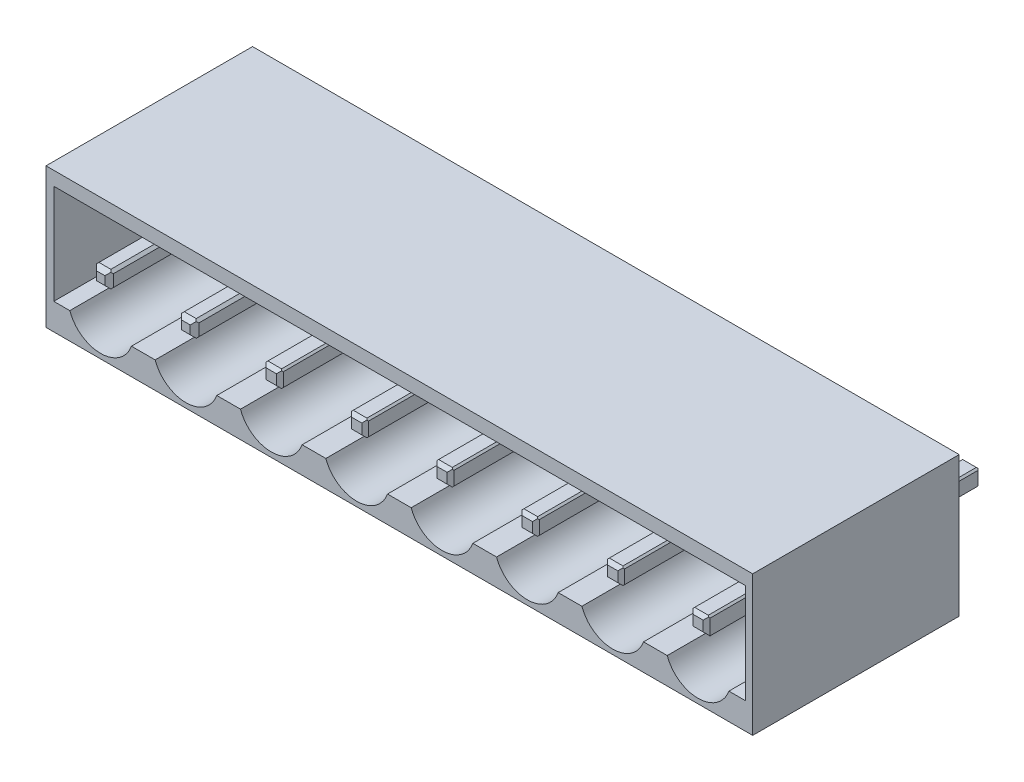
from build123d import *

# Parameters (mm, degrees)
SKETCH_1_W          = 41.4
SKETCH_1_H          = 8.2
EXTRUDE_1_DEPTH     = 12.1
SKETCH_4_R          = 1.25
CUT_EXTRUDE_3_DEPTH = 8
CUT_EXTRUDE_4_DEPTH = 7.8
SKETCH_7_W          = 1
SKETCH_7_H          = 1
EXTRUDE_2_DEPTH     = 8
CHAMFER_1_SIZE      = 0.15
CHAMFER_2_SIZE      = 0.25
SKETCH_8_W          = 1
SKETCH_8_H          = 1
EXTRUDE_3_DEPTH     = 4
CHAMFER_6_SIZE      = 0.1
CHAMFER_7_SIZE      = 0.2
CHAMFER_10_SIZE     = 0.1
CHAMFER_11_SIZE     = 0.2
CHAMFER_12_SIZE     = 0.1
CHAMFER_13_SIZE     = 0.2
CHAMFER_14_SIZE     = 0.1
CHAMFER_15_SIZE     = 0.2


with BuildPart() as part:
    # Эскиз1 → Бобышка-Вытянуть1 (new body)
    with BuildSketch(Plane.XY):
        Rectangle(SKETCH_1_W, SKETCH_1_H)
    extrude(amount=EXTRUDE_1_DEPTH)

    # Эскиз4 → Вырез-Вытянуть3 (cut)
    with BuildSketch(Plane.XY.offset(12.1)):
        with Locations((-17.5, 0)):
            Circle(SKETCH_4_R)
        with Locations((-12.5, 0)):
            Circle(SKETCH_4_R)
        with Locations((-7.5, 0)):
            Circle(SKETCH_4_R)
        with Locations((-2.5, 0)):
            Circle(SKETCH_4_R)
        with Locations((2.5, 0)):
            Circle(SKETCH_4_R)
        with Locations((7.5, 0)):
            Circle(SKETCH_4_R)
        with Locations((12.5, 0)):
            Circle(SKETCH_4_R)
        with Locations((17.5, 0)):
            Circle(SKETCH_4_R)
    extrude(amount=-CUT_EXTRUDE_3_DEPTH, mode=Mode.SUBTRACT)

    # Эскиз5 → Вырез-Вытянуть4 (cut)
    with BuildSketch(Plane.XY.offset(12.1)):
        with BuildLine():
            Line((-20.245621634, 0), (-20.245621634, 3.292901982))
            Line((-20.245621634, 3.292901982), (-9.721490456, 3.292901982))
            Line((-9.721490456, 3.292901982), (-4.721490456, 3.292901982))
            Line((-4.721490456, 3.292901982), (0.278509544, 3.292901982))
            Line((0.278509544, 3.292901982), (10.278509544, 3.292901982))
            Line((10.278509544, 3.292901982), (20.278509544, 3.292901982))
            Line((20.278509544, 3.292901982), (20.278509544, -2.548957219))
            Line((20.278509544, -2.548957219), (19.30582632, -2.548957219))
            ThreePointArc((19.30582632, -2.548957219), (17.5, -3.818893996), (15.69417368, -2.548957219))
            Line((15.69417368, -2.548957219), (14.30582632, -2.548957219))
            ThreePointArc((14.30582632, -2.548957219), (12.5, -3.818893996), (10.69417368, -2.548957219))
            Line((10.69417368, -2.548957219), (9.30582632, -2.548957219))
            ThreePointArc((9.30582632, -2.548957219), (7.5, -3.818893996), (5.69417368, -2.548957219))
            Line((5.69417368, -2.548957219), (4.30582632, -2.548957219))
            ThreePointArc((4.30582632, -2.548957219), (2.5, -3.818893996), (0.69417368, -2.548957219))
            Line((0.69417368, -2.548957219), (-0.69417368, -2.548957219))
            ThreePointArc((-0.69417368, -2.548957219), (-2.5, -3.818893996), (-4.30582632, -2.548957219))
            Line((-4.30582632, -2.548957219), (-5.69417368, -2.548957219))
            ThreePointArc((-5.69417368, -2.548957219), (-7.5, -3.818893996), (-9.30582632, -2.548957219))
            Line((-9.30582632, -2.548957219), (-10.69417368, -2.548957219))
            ThreePointArc((-10.69417368, -2.548957219), (-12.5, -3.818893996), (-14.30582632, -2.548957219))
            Line((-14.30582632, -2.548957219), (-15.69417368, -2.548957219))
            ThreePointArc((-15.69417368, -2.548957219), (-17.5, -3.818893996), (-19.30582632, -2.548957219))
            Line((-19.30582632, -2.548957219), (-20.245621634, -2.548957219))
            Line((-20.245621634, -2.548957219), (-20.245621634, 0))
        make_face()
    extrude(amount=-CUT_EXTRUDE_4_DEPTH, mode=Mode.SUBTRACT)

    # Эскиз7 → Бобышка-Вытянуть2 (add)
    with BuildSketch(Plane.XY.offset(4.1)):
        with Locations((-12.5, 0)):
            Rectangle(SKETCH_7_W, SKETCH_7_H)
        with Locations((-17.5, 0)):
            Rectangle(SKETCH_7_W, SKETCH_7_H)
        with Locations((-7.5, 0)):
            Rectangle(SKETCH_7_W, SKETCH_7_H)
        with Locations((-2.5, 0)):
            Rectangle(SKETCH_7_W, SKETCH_7_H)
        with Locations((2.5, 0)):
            Rectangle(SKETCH_7_W, SKETCH_7_H)
        with Locations((7.5, 0)):
            Rectangle(SKETCH_7_W, SKETCH_7_H)
        with Locations((12.5, 0)):
            Rectangle(SKETCH_7_W, SKETCH_7_H)
        with Locations((17.5, 0)):
            Rectangle(SKETCH_7_W, SKETCH_7_H)
    extrude(amount=EXTRUDE_2_DEPTH)

    # Фаска1
    chamfer_1_edges = [part.edges().sort_by_distance(p)[0] for p in [
        (-17, -0.5, 8.1),
        (-17, 0.5, 8.1),
        (-18, 0.5, 8.1),
        (-18, -0.5, 8.1),
        (-12, -0.5, 8.1),
        (-12, 0.5, 8.1),
        (-13, 0.5, 8.1),
        (-13, -0.5, 8.1),
    ]]
    chamfer(chamfer_1_edges, length=CHAMFER_1_SIZE)

    # Фаска2
    # the kernel refuses this chamfer: 0.25 mm, written as the material it takes off along each edge
    with BuildSketch(Plane(origin=(-13, -0.992920747, 12.1), x_dir=(-0.027495876610589005, 0, -0.9996219169112968), z_dir=(0, 1, 0)), Plane(origin=(-13.492920747, 0.5, 12.1), x_dir=(0, 0.027495876610586414, -0.9996219169112968), z_dir=(1, 0, 0)), Plane(origin=(-12, 0.992920747, 12.1), x_dir=(0.027495876610589005, 0, -0.9996219169112968), z_dir=(0, -1, 0)), Plane(origin=(-11.507079253, -0.5, 12.1), x_dir=(0, -0.027495876610586414, -0.9996219169112968), z_dir=(-1, 0, 0)), Plane(origin=(-17, 0.992920747, 12.1), x_dir=(0.027495876610582105, 0, -0.999621916911297), z_dir=(0, -1, 0)), Plane(origin=(-16.507079253, -0.5, 12.1), x_dir=(0, -0.027495876610586414, -0.9996219169112968), z_dir=(-1, 0, 0)), Plane(origin=(-18, -0.992920747, 12.1), x_dir=(-0.027495876610582105, 0, -0.999621916911297), z_dir=(0, 1, 0)), Plane(origin=(-18.492920747, 0.5, 12.1), x_dir=(0, 0.027495876610586414, -0.9996219169112968), z_dir=(1, 0, 0))) as chamfer_2_piece_1:
        Polygon((CHAMFER_2_SIZE * 0.999621916911, -CHAMFER_2_SIZE * 0.0274958766106), (-CHAMFER_2_SIZE * 0.0274958766106, -CHAMFER_2_SIZE * 0.999621916911), (0, 0), align=None)
    extrude(amount=1.985841494, mode=Mode.SUBTRACT)

    # Эскиз8 → Бобышка-Вытянуть3 (add)
    with BuildSketch(Plane(origin=(0, -4.1, 0), x_dir=(-1, 0, 0), z_dir=(0, 0, 1))):
        with Locations((12.5, -3.75)):
            Rectangle(SKETCH_8_W, SKETCH_8_H)
        with Locations((17.5, -3.75)):
            Rectangle(SKETCH_8_W, SKETCH_8_H)
        with Locations((7.5, -3.75)):
            Rectangle(SKETCH_8_W, SKETCH_8_H)
        with Locations((2.5, -3.75)):
            Rectangle(SKETCH_8_W, SKETCH_8_H)
        with Locations((-2.5, -3.75)):
            Rectangle(SKETCH_8_W, SKETCH_8_H)
        with Locations((-7.5, -3.75)):
            Rectangle(SKETCH_8_W, SKETCH_8_H)
        with Locations((-12.5, -3.75)):
            Rectangle(SKETCH_8_W, SKETCH_8_H)
        with Locations((-17.5, -3.75)):
            Rectangle(SKETCH_8_W, SKETCH_8_H)
    extrude(amount=-EXTRUDE_3_DEPTH)

    # Фаска6
    chamfer_6_edges = [part.edges().sort_by_distance(p)[0] for p in [
        (-7, -0.5, 8.1),
        (-7, 0.5, 8.1),
        (-8, 0.5, 8.1),
        (-8, -0.5, 8.1),
    ]]
    chamfer(chamfer_6_edges, length=CHAMFER_6_SIZE)

    # Фаска7
    # the kernel refuses this chamfer: 0.2 mm, written as the material it takes off along each edge
    with BuildSketch(Plane(origin=(-7, 0.914336598, 12.1), x_dir=(0.02749587661058742, 0, -0.9996219169112966), z_dir=(0, -1, 0)), Plane(origin=(-6.585663402, -0.5, 12.1), x_dir=(0, -0.02749587661058634, -0.9996219169112966), z_dir=(-1, 0, 0)), Plane(origin=(-8, -0.914336598, 12.1), x_dir=(-0.02749587661058742, 0, -0.9996219169112966), z_dir=(0, 1, 0)), Plane(origin=(-8.414336598, 0.5, 12.1), x_dir=(0, 0.02749587661058634, -0.9996219169112966), z_dir=(1, 0, 0))) as chamfer_7_piece_1:
        Polygon((CHAMFER_7_SIZE * 0.999621916911, -CHAMFER_7_SIZE * 0.0274958766106), (-CHAMFER_7_SIZE * 0.0274958766106, -CHAMFER_7_SIZE * 0.999621916911), (0, 0), align=None)
    extrude(amount=1.828673195, mode=Mode.SUBTRACT)

    # Фаска10
    chamfer_10_edges = [part.edges().sort_by_distance(p)[0] for p in [
        (-17, 0.15, -2),
        (-17, -0.85, -2),
        (-18, -0.85, -2),
        (-18, 0.15, -2),
        (-12, 0.15, -2),
        (-12, -0.85, -2),
        (-13, -0.85, -2),
        (-13, 0.15, -2),
        (-7, 0.15, -2),
        (-7, -0.85, -2),
        (-8, -0.85, -2),
        (-8, 0.15, -2),
    ]]
    chamfer(chamfer_10_edges, length=CHAMFER_10_SIZE)

    # Фаска11
    # the kernel refuses this chamfer: 0.2 mm, written as the material it takes off along each edge
    with BuildSketch(Plane(origin=(-17, 0.564336598, -4), x_dir=(0.027495876610578673, 0, 0.999621916911297), z_dir=(0, -1, 0)), Plane(origin=(-18.414336598, 0.15, -4), x_dir=(0, 0.027495876610586355, 0.9996219169112966), z_dir=(1, 0, 0)), Plane(origin=(-18, -1.264336598, -4), x_dir=(-0.027495876610578673, 0, 0.999621916911297), z_dir=(0, 1, 0)), Plane(origin=(-16.585663402, -0.85, -4), x_dir=(0, -0.027495876610586223, 0.9996219169112966), z_dir=(-1, 0, 0)), Plane(origin=(-11.585663402, -0.85, -4), x_dir=(0, -0.027495876610586223, 0.9996219169112966), z_dir=(-1, 0, 0)), Plane(origin=(-13, -1.264336598, -4), x_dir=(-0.027495876610587302, 0, 0.9996219169112966), z_dir=(0, 1, 0)), Plane(origin=(-13.414336598, 0.15, -4), x_dir=(0, 0.027495876610586355, 0.9996219169112966), z_dir=(1, 0, 0)), Plane(origin=(-12, 0.564336598, -4), x_dir=(0.027495876610587302, 0, 0.9996219169112966), z_dir=(0, -1, 0)), Plane(origin=(-8, -1.264336598, -4), x_dir=(-0.027495876610587302, 0, 0.9996219169112966), z_dir=(0, 1, 0)), Plane(origin=(-8.414336598, 0.15, -4), x_dir=(0, 0.027495876610586355, 0.9996219169112966), z_dir=(1, 0, 0)), Plane(origin=(-7, 0.564336598, -4), x_dir=(0.027495876610587302, 0, 0.9996219169112966), z_dir=(0, -1, 0)), Plane(origin=(-6.585663402, -0.85, -4), x_dir=(0, -0.027495876610586223, 0.9996219169112966), z_dir=(-1, 0, 0))) as chamfer_11_piece_1:
        Polygon((CHAMFER_11_SIZE * 0.999621916911, CHAMFER_11_SIZE * 0.0274958766106), (-CHAMFER_11_SIZE * 0.0274958766106, CHAMFER_11_SIZE * 0.999621916911), (0, 0), align=None)
    extrude(amount=1.828673195, mode=Mode.SUBTRACT)

    # Фаска12
    chamfer_12_edges = [part.edges().sort_by_distance(p)[0] for p in [
        (3, -0.5, 8.1),
        (3, 0.5, 8.1),
        (2, 0.5, 8.1),
        (2, -0.5, 8.1),
        (8, -0.5, 8.1),
        (8, 0.5, 8.1),
        (7, 0.5, 8.1),
        (7, -0.5, 8.1),
        (-2, 0.15, -2),
        (-2, -0.85, -2),
        (-3, -0.85, -2),
        (-3, 0.15, -2),
        (3, 0.15, -2),
        (3, -0.85, -2),
        (2, -0.85, -2),
        (2, 0.15, -2),
        (8, 0.15, -2),
        (8, -0.85, -2),
        (7, -0.85, -2),
        (7, 0.15, -2),
    ]]
    chamfer(chamfer_12_edges, length=CHAMFER_12_SIZE)

    # Фаска13
    # the kernel refuses this chamfer: 0.2 mm, written as the material it takes off along each edge
    with BuildSketch(Plane(origin=(-3.414336598, 0.15, -4), x_dir=(0, 0.027495876610586355, 0.9996219169112966), z_dir=(1, 0, 0)), Plane(origin=(-2, 0.564336598, -4), x_dir=(0.027495876610586223, 0, 0.9996219169112966), z_dir=(0, -1, 0)), Plane(origin=(-3, -1.264336598, -4), x_dir=(-0.027495876610587302, 0, 0.9996219169112966), z_dir=(0, 1, 0)), Plane(origin=(-1.585663402, -0.85, -4), x_dir=(0, -0.027495876610586223, 0.9996219169112966), z_dir=(-1, 0, 0))) as chamfer_13_piece_1:
        Polygon((CHAMFER_13_SIZE * 0.999621916911, CHAMFER_13_SIZE * 0.0274958766106), (-CHAMFER_13_SIZE * 0.0274958766106, CHAMFER_13_SIZE * 0.999621916911), (0, 0), align=None)
    extrude(amount=1.828673195, mode=Mode.SUBTRACT)

    # Фаска14
    chamfer_14_edges = [part.edges().sort_by_distance(p)[0] for p in [
        (-2, -0.5, 8.1),
        (-2, 0.5, 8.1),
        (-3, 0.5, 8.1),
        (-3, -0.5, 8.1),
        (13, -0.5, 8.1),
        (13, 0.5, 8.1),
        (12, 0.5, 8.1),
        (12, -0.5, 8.1),
        (18, 0.5, 8.1),
        (17, 0.5, 8.1),
        (13, 0.15, -2),
        (13, -0.85, -2),
        (12, -0.85, -2),
        (12, 0.15, -2),
        (18, 0.15, -2),
        (18, -0.85, -2),
        (17, -0.85, -2),
        (17, 0.15, -2),
    ]]
    chamfer(chamfer_14_edges, length=CHAMFER_14_SIZE)

    # Фаска15
    # the kernel refuses this chamfer: 0.2 mm, written as the material it takes off along each edge
    with BuildSketch(Plane(origin=(-3, -0.914336598, 12.1), x_dir=(-0.02749587661058742, 0, -0.9996219169112966), z_dir=(0, 1, 0)), Plane(origin=(-1.585663402, -0.5, 12.1), x_dir=(0, -0.02749587661058634, -0.9996219169112966), z_dir=(-1, 0, 0)), Plane(origin=(-2, 0.914336598, 12.1), x_dir=(0.02749587661058634, 0, -0.9996219169112966), z_dir=(0, -1, 0)), Plane(origin=(-3.414336598, 0.5, 12.1), x_dir=(0, 0.02749587661058634, -0.9996219169112966), z_dir=(1, 0, 0)), Plane(origin=(8, 0.914336598, 12.1), x_dir=(0.02749587661058742, 0, -0.9996219169112966), z_dir=(0, -1, 0)), Plane(origin=(8.414336598, -0.5, 12.1), x_dir=(0, -0.02749587661058634, -0.9996219169112966), z_dir=(-1, 0, 0)), Plane(origin=(7, -0.914336598, 12.1), x_dir=(-0.02749587661058742, 0, -0.9996219169112966), z_dir=(0, 1, 0)), Plane(origin=(6.585663402, 0.5, 12.1), x_dir=(0, 0.02749587661058634, -0.9996219169112966), z_dir=(1, 0, 0)), Plane(origin=(3.414336598, -0.5, 12.1), x_dir=(0, -0.02749587661058634, -0.9996219169112966), z_dir=(-1, 0, 0)), Plane(origin=(3, 0.914336598, 12.1), x_dir=(0.02749587661058742, 0, -0.9996219169112966), z_dir=(0, -1, 0)), Plane(origin=(2, -0.914336598, 12.1), x_dir=(-0.02749587661058634, 0, -0.9996219169112966), z_dir=(0, 1, 0)), Plane(origin=(1.585663402, 0.5, 12.1), x_dir=(0, 0.02749587661058634, -0.9996219169112966), z_dir=(1, 0, 0)), Plane(origin=(16.585663402, 0.5, 12.1), x_dir=(0, 0.02749587661058634, -0.9996219169112966), z_dir=(1, 0, 0)), Plane(origin=(12, -0.914336598, 12.1), x_dir=(-0.02749587661058742, 0, -0.9996219169112966), z_dir=(0, 1, 0)), Plane(origin=(13.414336598, -0.5, 12.1), x_dir=(0, -0.02749587661058634, -0.9996219169112966), z_dir=(-1, 0, 0)), Plane(origin=(13, 0.914336598, 12.1), x_dir=(0.02749587661058742, 0, -0.9996219169112966), z_dir=(0, -1, 0)), Plane(origin=(11.585663402, 0.5, 12.1), x_dir=(0, 0.02749587661058634, -0.9996219169112966), z_dir=(1, 0, 0))) as chamfer_15_piece_1:
        Polygon((CHAMFER_15_SIZE * 0.999621916911, -CHAMFER_15_SIZE * 0.0274958766106), (-CHAMFER_15_SIZE * 0.0274958766106, -CHAMFER_15_SIZE * 0.999621916911), (0, 0), align=None)
    extrude(amount=1.828673195, mode=Mode.SUBTRACT)
    with BuildSketch(Plane(origin=(2, -1.264336598, -4), x_dir=(-0.027495876610586223, 0, 0.9996219169112966), z_dir=(0, 1, 0)), Plane(origin=(3.414336598, -0.85, -4), x_dir=(0, -0.027495876610586223, 0.9996219169112966), z_dir=(-1, 0, 0)), Plane(origin=(3, 0.564336598, -4), x_dir=(0.027495876610587302, 0, 0.9996219169112966), z_dir=(0, -1, 0)), Plane(origin=(1.585663402, 0.15, -4), x_dir=(0, 0.027495876610586355, 0.9996219169112966), z_dir=(1, 0, 0)), Plane(origin=(7, -1.264336598, -4), x_dir=(-0.027495876610587302, 0, 0.9996219169112966), z_dir=(0, 1, 0)), Plane(origin=(8.414336598, -0.85, -4), x_dir=(0, -0.027495876610586223, 0.9996219169112966), z_dir=(-1, 0, 0)), Plane(origin=(8, 0.564336598, -4), x_dir=(0.027495876610587302, 0, 0.9996219169112966), z_dir=(0, -1, 0)), Plane(origin=(6.585663402, 0.15, -4), x_dir=(0, 0.027495876610586355, 0.9996219169112966), z_dir=(1, 0, 0)), Plane(origin=(18.414336598, -0.85, -4), x_dir=(0, -0.027495876610586223, 0.9996219169112966), z_dir=(-1, 0, 0)), Plane(origin=(18, 0.564336598, -4), x_dir=(0.027495876610578673, 0, 0.999621916911297), z_dir=(0, -1, 0)), Plane(origin=(17, -1.264336598, -4), x_dir=(-0.027495876610578673, 0, 0.999621916911297), z_dir=(0, 1, 0)), Plane(origin=(16.585663402, 0.15, -4), x_dir=(0, 0.027495876610586355, 0.9996219169112966), z_dir=(1, 0, 0)), Plane(origin=(13, 0.564336598, -4), x_dir=(0.027495876610587302, 0, 0.9996219169112966), z_dir=(0, -1, 0)), Plane(origin=(13.414336598, -0.85, -4), x_dir=(0, -0.027495876610586223, 0.9996219169112966), z_dir=(-1, 0, 0)), Plane(origin=(12, -1.264336598, -4), x_dir=(-0.027495876610587302, 0, 0.9996219169112966), z_dir=(0, 1, 0)), Plane(origin=(11.585663402, 0.15, -4), x_dir=(0, 0.027495876610586355, 0.9996219169112966), z_dir=(1, 0, 0))) as chamfer_15_piece_2:
        Polygon((CHAMFER_15_SIZE * 0.999621916911, CHAMFER_15_SIZE * 0.0274958766106), (-CHAMFER_15_SIZE * 0.0274958766106, CHAMFER_15_SIZE * 0.999621916911), (0, 0), align=None)
    extrude(amount=1.828673195, mode=Mode.SUBTRACT)
    with BuildSketch(Plane(origin=(18, 0.914336598, 12.1), x_dir=(0.02749587661057879, 0, -0.999621916911297), z_dir=(0, -1, 0)), Plane(origin=(17, -1.014336598, 12.1), x_dir=(-0.02749587661057879, 0, -0.999621916911297), z_dir=(0, 1, 0))) as chamfer_15_piece_3:
        Polygon((CHAMFER_15_SIZE * 0.999621916911, -CHAMFER_15_SIZE * 0.0274958766106), (-CHAMFER_15_SIZE * 0.0274958766106, -CHAMFER_15_SIZE * 0.999621916911), (0, 0), align=None)
    extrude(amount=1.928673195, mode=Mode.SUBTRACT)
    with BuildSketch(Plane(origin=(18.514336598, -0.5, 12.1), x_dir=(0, -0.02749587661058634, -0.9996219169112966), z_dir=(-1, 0, 0))) as chamfer_15_piece_4:
        Polygon((CHAMFER_15_SIZE * 0.999621916911, -CHAMFER_15_SIZE * 0.0274958766106), (-CHAMFER_15_SIZE * 0.0274958766106, -CHAMFER_15_SIZE * 0.999621916911), (0, 0), align=None)
    extrude(amount=2.028673195, mode=Mode.SUBTRACT)


solid = part.part
